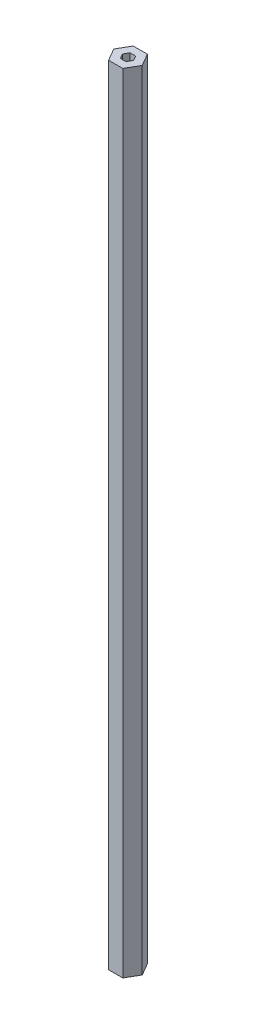
from build123d import *

# Parameters (mm, degrees)
BOSS_EXTRUDE1_DEPTH = 406.4


with BuildPart() as part:
    # Sketch1 → Boss-Extrude1 (new body)
    with BuildSketch(Plane(origin=(0, 0, 0), x_dir=(1, 0, 0), z_dir=(0, 1, 0))):
        Polygon((7.332348419, 0), (3.666174209, 6.35), (-3.666174209, 6.35), (-7.332348419, 0), (-3.666174209, -6.35), (3.666174209, -6.35), align=None)
        Polygon((1.443375673, 2.5), (-1.443375673, 2.5), (-2.886751346, 0), (-1.443375673, -2.5), (1.443375673, -2.5), (2.886751346, 0), align=None, mode=Mode.SUBTRACT)
    extrude(amount=BOSS_EXTRUDE1_DEPTH)


solid = part.part
